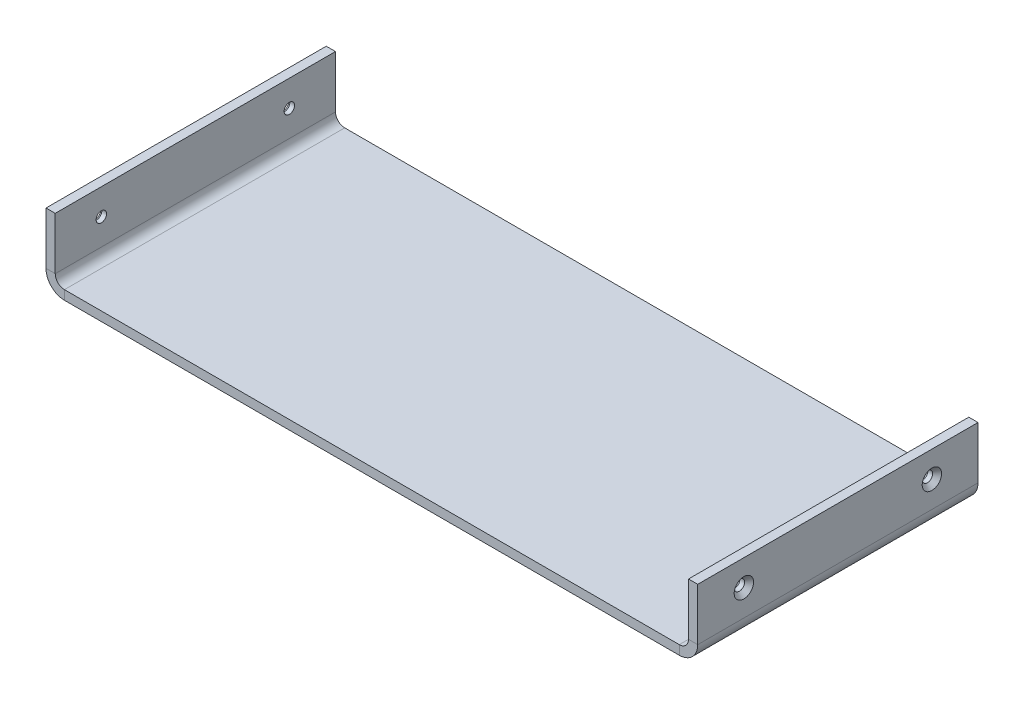
from build123d import *

# Parameters (mm, degrees)
SKETCH_1_W                            = 200
SKETCH_1_H                            = 91.16
SM_BASE_FLANGE_1_DEPTH                = 3
SM_EDGE_FLANGE_1_DEPTH                = 91.16
SM_EDGE_FLANGE_1_BEND_DEPTH           = 91.16
HOLE_WIZARD_M31_D                     = 3.4
HOLE_WIZARD_M31_DEPTH                 = 8.5
HOLE_WIZARD_M31_CSINK_D               = 6.3
HOLE_WIZARD_M31_CSINK_ANGLE           = 90
HOLE_WIZARD_M31_TIP                   = 1.021463052
HOLE_WIZARD_M31_ON_FACE_2_D           = 3.4
HOLE_WIZARD_M31_ON_FACE_2_DEPTH       = 8.5
HOLE_WIZARD_M31_ON_FACE_2_CSINK_D     = 6.3
HOLE_WIZARD_M31_ON_FACE_2_CSINK_ANGLE = 90
HOLE_WIZARD_M31_ON_FACE_2_TIP         = 1.021463052


# Sheet-metal steps are written as plain solids
with BuildPart() as part:
    # Sketch 1 → Базовая кромка1 (new body)
    with BuildSketch(Plane(origin=(0, 0, 0), x_dir=(1, 0, 0), z_dir=(0, 1, 0))):
        Rectangle(SKETCH_1_W, SKETCH_1_H)
    extrude(amount=-SM_BASE_FLANGE_1_DEPTH)

    # Ребро-кромка1 section (across the edge) → Ребро-кромка1 (add)
    with BuildSketch(Plane(origin=(-103, 0, -45.58), x_dir=(1, 0, 0), z_dir=(0, 0, 1))):
        with BuildLine():
            Line((-3, 3), (-3, 20))
            Line((-3, 20), (0, 20))
            Line((0, 20), (0, 3))
            ThreePointArc((0, 3), (0.878679656, 0.878679656), (3, 0))
            Line((3, 0), (3, -3))
            ThreePointArc((3, -3), (-1.242640687, -1.242640687), (-3, 3))
        make_face()
    extrude(amount=SM_EDGE_FLANGE_1_DEPTH)

    # Ребро-кромка1 section 2 (across the edge) → Ребро-кромка1 bend (add)
    with BuildSketch(Plane(origin=(103, 0, 45.58), x_dir=(-1, 0, 0), z_dir=(0, 0, -1))):
        with BuildLine():
            Line((-3, 3), (-3, 20))
            Line((-3, 20), (0, 20))
            Line((0, 20), (0, 3))
            ThreePointArc((0, 3), (0.878679656, 0.878679656), (3, 0))
            Line((3, 0), (3, -3))
            ThreePointArc((3, -3), (-1.242640687, -1.242640687), (-3, 3))
        make_face()
    extrude(amount=SM_EDGE_FLANGE_1_BEND_DEPTH)

    # Зенковка для  винта с плоской головкой M31
    with Locations(Plane(origin=(106, 11.522322038, 30.580016609), x_dir=(0, 1, 0), z_dir=(1, 0, 0))):
        with Locations((0, 0), (-0.022322038, -61.160016609)):
            CounterSinkHole(HOLE_WIZARD_M31_D / 2, HOLE_WIZARD_M31_CSINK_D / 2, depth=HOLE_WIZARD_M31_DEPTH, counter_sink_angle=HOLE_WIZARD_M31_CSINK_ANGLE)
            with Locations((0, 0, -(HOLE_WIZARD_M31_DEPTH + HOLE_WIZARD_M31_TIP / 2))):  # 118° drill point
                Cone(0, HOLE_WIZARD_M31_D / 2, HOLE_WIZARD_M31_TIP, mode=Mode.SUBTRACT)

    # Зенковка для  винта с плоской головкой M31 on face 2
    with Locations(Plane(origin=(-106, 11.5, -30.58), x_dir=(0, 0, -1), z_dir=(-1, 0, 0))):
        with Locations((0, 0), (-61.160016609, -0.022322038)):
            CounterSinkHole(HOLE_WIZARD_M31_ON_FACE_2_D / 2, HOLE_WIZARD_M31_ON_FACE_2_CSINK_D / 2, depth=HOLE_WIZARD_M31_ON_FACE_2_DEPTH, counter_sink_angle=HOLE_WIZARD_M31_ON_FACE_2_CSINK_ANGLE)
            with Locations((0, 0, -(HOLE_WIZARD_M31_ON_FACE_2_DEPTH + HOLE_WIZARD_M31_ON_FACE_2_TIP / 2))):  # 118° drill point
                Cone(0, HOLE_WIZARD_M31_ON_FACE_2_D / 2, HOLE_WIZARD_M31_ON_FACE_2_TIP, mode=Mode.SUBTRACT)


solid = part.part
